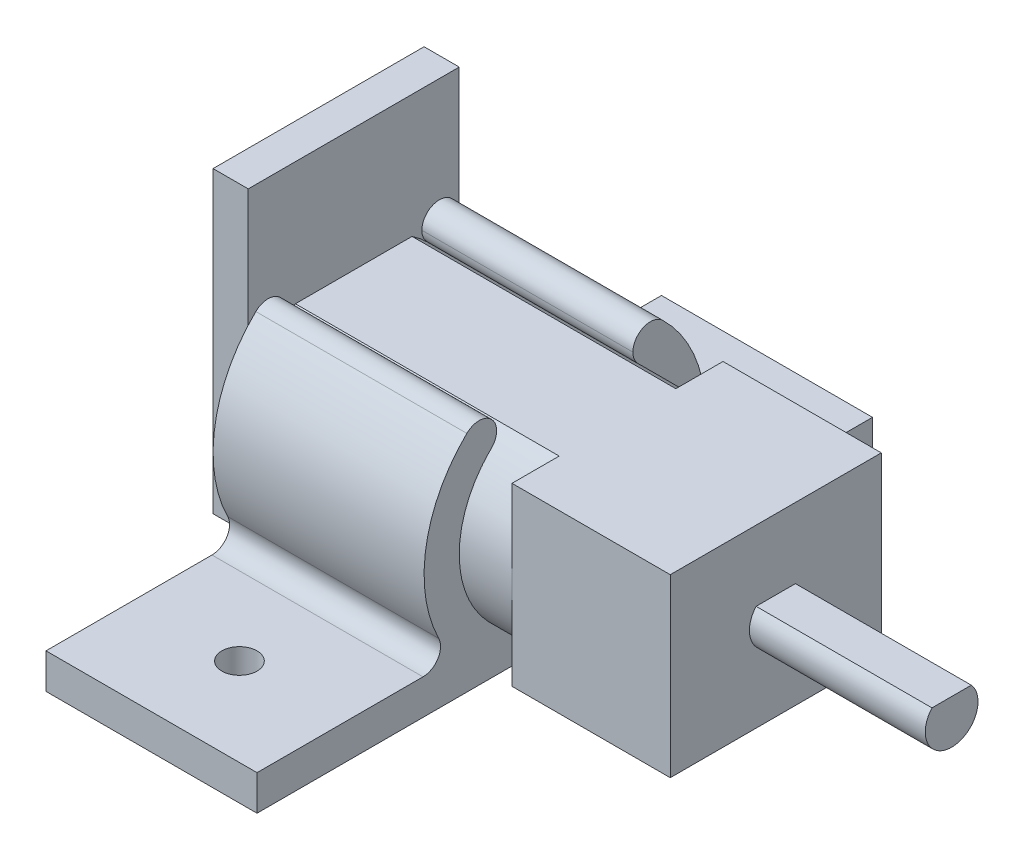
from build123d import *

# Parameters (mm, degrees)
BOSS_EXTRUDE1_DEPTH = 2
BOSS_EXTRUDE2_DEPTH = 24
CUT_EXTRUDE1_DEPTH  = 15
BOSS_EXTRUDE3_DEPTH = 34
BOSS_EXTRUDE4_DEPTH = 12
SKETCH3_R           = 1
CUT_EXTRUDE2_DEPTH  = 13
FILLET1_R           = 1


with BuildPart() as part:
    # Sketch1 → Boss-Extrude1 (new body)
    with BuildSketch(Plane(origin=(0, 0, 0), x_dir=(0, 0, -1), z_dir=(1, 0, 0))):
        Polygon((0, 17), (0, 10), (2.68337521, 10), (6, 10), (9.31662479, 10), (12, 10), (12, 17), align=None)
        with BuildLine():
            Line((2.68337521, 10), (0, 10))
            Line((0, 10), (0, 5.000000026))
            ThreePointArc((0, 5.000000026), (0.713235932, 7.837274342), (2.68337521, 10))
        make_face()
        with BuildLine():
            Line((9.31662479, 10), (6, 10))
            Line((6, 10), (6, 6))
            Line((6, 6), (7.118033989, 6))
            ThreePointArc((7.118033989, 6), (7.369306394, 4.387627564), (6, 3.5))
            Line((6, 3.5), (6, 0))
            Line((6, 0), (9.31662479, 0))
            ThreePointArc((9.31662479, 0), (11.286764069, 2.16272566), (12, 4.999999979))
            ThreePointArc((12, 4.999999979), (11.286764079, 7.837274322), (9.31662479, 10))
        make_face()
        with BuildLine():
            Line((12, 10), (9.31662479, 10))
            ThreePointArc((9.31662479, 10), (11.286764079, 7.837274322), (12, 4.999999979))
            Line((12, 4.999999979), (12, 10))
        make_face()
        with BuildLine():
            Line((12, 0), (12, 4.999999979))
            ThreePointArc((12, 4.999999979), (11.286764069, 2.16272566), (9.31662479, 0))
            Line((9.31662479, 0), (12, 0))
        make_face()
        with BuildLine():
            ThreePointArc((2.68337521, 0), (0.71323592, 2.16272568), (0, 5.000000026))
            Line((0, 5.000000026), (0, 0))
            Line((0, 0), (2.68337521, 0))
        make_face()
        with BuildLine():
            Line((6, 10), (2.68337521, 10))
            ThreePointArc((2.68337521, 10), (0.713235932, 7.837274342), (0, 5.000000026))
            ThreePointArc((0, 5.000000026), (0.71323592, 2.16272568), (2.68337521, 0))
            Line((2.68337521, 0), (6, 0))
            Line((6, 0), (6, 3.5))
            ThreePointArc((6, 3.5), (4.630693606, 4.387627564), (4.881966011, 6))
            Line((4.881966011, 6), (6, 6))
            Line((6, 6), (6, 10))
        make_face()
        with BuildLine():
            Line((7.118033989, 6), (6, 6))
            Line((6, 6), (6, 3.5))
            ThreePointArc((6, 3.5), (7.369306394, 4.387627564), (7.118033989, 6))
        make_face()
        with BuildLine():
            Line((6, 3.5), (6, 6))
            Line((6, 6), (4.881966011, 6))
            ThreePointArc((4.881966011, 6), (4.630693606, 4.387627564), (6, 3.5))
        make_face()
    extrude(amount=-BOSS_EXTRUDE1_DEPTH)

    # Sketch1<3> → Boss-Extrude2 (add)
    with BuildSketch(Plane(origin=(0, 0, 0), x_dir=(0, 0, -1), z_dir=(1, 0, 0))):
        with BuildLine():
            Line((9.31662479, 10), (6, 10))
            Line((6, 10), (6, 6))
            Line((6, 6), (7.118033989, 6))
            ThreePointArc((7.118033989, 6), (7.369306394, 4.387627564), (6, 3.5))
            Line((6, 3.5), (6, 0))
            Line((6, 0), (9.31662479, 0))
            ThreePointArc((9.31662479, 0), (11.286764069, 2.16272566), (12, 4.999999979))
            ThreePointArc((12, 4.999999979), (11.286764079, 7.837274322), (9.31662479, 10))
        make_face()
        with BuildLine():
            Line((12, 10), (9.31662479, 10))
            ThreePointArc((9.31662479, 10), (11.286764079, 7.837274322), (12, 4.999999979))
            Line((12, 4.999999979), (12, 10))
        make_face()
        with BuildLine():
            Line((12, 0), (12, 4.999999979))
            ThreePointArc((12, 4.999999979), (11.286764069, 2.16272566), (9.31662479, 0))
            Line((9.31662479, 0), (12, 0))
        make_face()
        with BuildLine():
            Line((6, 10), (2.68337521, 10))
            ThreePointArc((2.68337521, 10), (0.713235932, 7.837274342), (0, 5.000000026))
            ThreePointArc((0, 5.000000026), (0.71323592, 2.16272568), (2.68337521, 0))
            Line((2.68337521, 0), (6, 0))
            Line((6, 0), (6, 3.5))
            ThreePointArc((6, 3.5), (4.630693606, 4.387627564), (4.881966011, 6))
            Line((4.881966011, 6), (6, 6))
            Line((6, 6), (6, 10))
        make_face()
        with BuildLine():
            ThreePointArc((2.68337521, 0), (0.71323592, 2.16272568), (0, 5.000000026))
            Line((0, 5.000000026), (0, 0))
            Line((0, 0), (2.68337521, 0))
        make_face()
        with BuildLine():
            Line((2.68337521, 10), (0, 10))
            Line((0, 10), (0, 5.000000026))
            ThreePointArc((0, 5.000000026), (0.713235932, 7.837274342), (2.68337521, 10))
        make_face()
        with BuildLine():
            Line((7.118033989, 6), (6, 6))
            Line((6, 6), (6, 3.5))
            ThreePointArc((6, 3.5), (7.369306394, 4.387627564), (7.118033989, 6))
        make_face()
        with BuildLine():
            Line((6, 3.5), (6, 6))
            Line((6, 6), (4.881966011, 6))
            ThreePointArc((4.881966011, 6), (4.630693606, 4.387627564), (6, 3.5))
        make_face()
    extrude(amount=BOSS_EXTRUDE2_DEPTH)

    # Sketch1<4> → Cut-Extrude1 (cut)
    with BuildSketch(Plane(origin=(0, 0, 0), x_dir=(0, 0, -1), z_dir=(1, 0, 0))):
        with BuildLine():
            Line((12, 10), (9.31662479, 10))
            ThreePointArc((9.31662479, 10), (11.286764079, 7.837274322), (12, 4.999999979))
            Line((12, 4.999999979), (12, 10))
        make_face()
        with BuildLine():
            Line((2.68337521, 10), (0, 10))
            Line((0, 10), (0, 5.000000026))
            ThreePointArc((0, 5.000000026), (0.713235932, 7.837274342), (2.68337521, 10))
        make_face()
        with BuildLine():
            ThreePointArc((2.68337521, 0), (0.71323592, 2.16272568), (0, 5.000000026))
            Line((0, 5.000000026), (0, 0))
            Line((0, 0), (2.68337521, 0))
        make_face()
        with BuildLine():
            Line((12, 0), (12, 4.999999979))
            ThreePointArc((12, 4.999999979), (11.286764069, 2.16272566), (9.31662479, 0))
            Line((9.31662479, 0), (12, 0))
        make_face()
    extrude(amount=CUT_EXTRUDE1_DEPTH, mode=Mode.SUBTRACT)

    # Sketch1<5> → Boss-Extrude3 (add)
    with BuildSketch(Plane(origin=(0, 0, 0), x_dir=(0, 0, -1), z_dir=(1, 0, 0))):
        with BuildLine():
            Line((7.118033989, 6), (6, 6))
            Line((6, 6), (6, 3.5))
            ThreePointArc((6, 3.5), (7.369306394, 4.387627564), (7.118033989, 6))
        make_face()
        with BuildLine():
            Line((6, 3.5), (6, 6))
            Line((6, 6), (4.881966011, 6))
            ThreePointArc((4.881966011, 6), (4.630693606, 4.387627564), (6, 3.5))
        make_face()
    extrude(amount=BOSS_EXTRUDE3_DEPTH)


with BuildPart() as body_2:
    # Sketch2 → Boss-Extrude4 (new body)
    with BuildSketch(Plane(origin=(0, 0, 0), x_dir=(0, 0, -1), z_dir=(1, 0, 0))):
        with BuildLine():
            Line((0, 10.291502622), (0, 5))
            ThreePointArc((0, 5), (0.557670532, 7.526074021), (2.127016654, 9.582575695))
            Line((2.127016654, 9.582575695), (2.127016654, 12))
            ThreePointArc((2.127016654, 12), (0.990140635, 11.237091401), (0, 10.291502622))
        make_face()
        with BuildLine():
            Line((9.31662479, 0), (2.68337521, 0))
            ThreePointArc((2.68337521, 0), (0.713235926, 2.162725669), (0, 5))
            Line((0, 5), (0, 10.291502622))
            ThreePointArc((0, 10.291502622), (-1.483314774, 7.828427125), (-2, 5))
            ThreePointArc((-2, 5), (-1.548509256, 2.350470229), (-0.244997998, 0))
            Line((-0.244997998, 0), (-11.5, 0))
            Line((-11.5, 0), (-11.5, -2))
            Line((-11.5, -2), (23.5, -2))
            Line((23.5, -2), (23.5, 0))
            Line((23.5, 0), (12.244997998, 0))
            ThreePointArc((12.244997998, 0), (13.548509256, 2.350470229), (14, 5))
            ThreePointArc((14, 5), (13.483314774, 7.828427125), (12, 10.291502622))
            Line((12, 10.291502622), (12, 5))
            ThreePointArc((12, 5), (11.286764074, 2.162725669), (9.31662479, 0))
        make_face()
        with BuildLine():
            ThreePointArc((9.872983346, 9.582575695), (11.442329468, 7.526074021), (12, 5))
            Line((12, 5), (12, 10.291502622))
            ThreePointArc((12, 10.291502622), (11.009859365, 11.237091401), (9.872983346, 12))
            Line((9.872983346, 12), (9.872983346, 9.582575695))
        make_face()
    extrude(amount=BOSS_EXTRUDE4_DEPTH)

    # Sketch3 → Cut-Extrude2 (cut)
    with BuildSketch(Plane.XZ.offset(2)):
        with Locations(Location((6, 6.5, 0), (0, 0, 270))):
            Circle(SKETCH3_R)
        with Locations(Location((6, -18.5, 0), (0, 0, 270))):
            Circle(SKETCH3_R)
    extrude(amount=-CUT_EXTRUDE2_DEPTH, mode=Mode.SUBTRACT)

    # Fillet1
    fillet1_edges = [body_2.edges().sort_by_distance(p)[0] for p in [
        (6, 0, -12.244997998),
        (6, 0, 0.244997998),
        (6, 9.582575695, -2.127016654),
        (6, 9.582575695, -9.872983346),
        (6, 12, -9.872983346),
        (6, 12, -2.127016654),
    ]]
    fillet(fillet1_edges, radius=FILLET1_R - 0.0001)  # a hair under: the kernel refuses the full size


solid = Compound([part.part, body_2.part])
